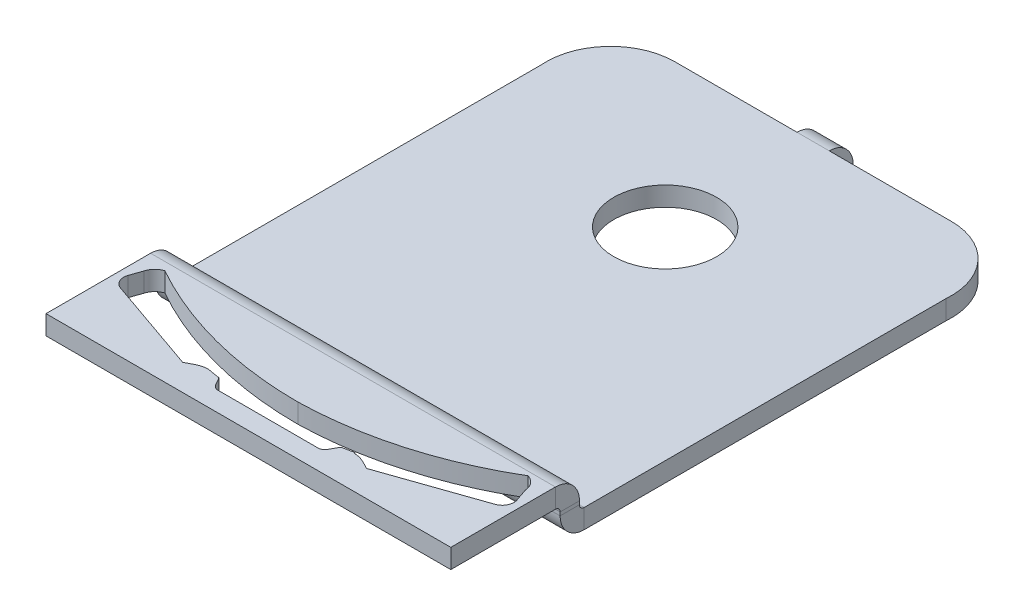
from build123d import *

# Parameters (mm, degrees)
BASE_FLANGE1_DEPTH           = 3
SKETCH2_R                    = 8
CUT_EXTRUDE1_DEPTH           = 73.112420355
EDGE_FLANGE1_STRIP_W         = 13.4732
EDGE_FLANGE1_STRIP_H         = 3
EDGE_FLANGE1_STRIP_CUT_DEPTH = 62.933077126
EDGE_FLANGE1_DEPTH           = 62.933077126
EDGE_FLANGE2_STRIP_W         = 13.4732
EDGE_FLANGE2_STRIP_H         = 3
EDGE_FLANGE2_STRIP_CUT_DEPTH = 62.933077126
EDGE_FLANGE2_DEPTH           = 62.933077126
CUT_EXTRUDE14_DEPTH          = 73.492766325
CUT_EXTRUDE15_DEPTH          = 73.492766325
CUT_EXTRUDE16_DEPTH          = 73.492766325
SKETCHED_START               = -2.498589927
SKETCHED_BEND2_DEPTH         = 5
SKETCHED_BEND2_2_DEPTH       = 5


# Read off the part's stored shape, not the designer's step: Sketched Bend2
# Sheet-metal steps are written as plain solids
with BuildPart() as part:
    # Sketch1 → Base-Flange1 (new body)
    with BuildSketch(Plane(origin=(0, 0, 0), x_dir=(1, 0, 0), z_dir=(0, 1, 0))):
        with BuildLine():
            Line((2.501410073, 64.8), (-2.498589927, 64.8))
            Line((-2.498589927, 64.8), (-2.498589927, 44.8))
            Line((-2.498589927, 44.8), (-21.498589927, 44.8))
            ThreePointArc((-21.498589927, 44.8), (-28.847059156, 41.582329983), (-31.466538563, 34))
            Line((-31.466538563, 34), (-31.466538563, -26))
            Line((-31.466538563, -26), (31.466538563, -26))
            Line((31.466538563, -26), (31.466538563, 34))
            ThreePointArc((31.466538563, 34), (28.848015597, 41.581293991), (21.501410073, 44.8))
            Line((21.501410073, 44.8), (2.501410073, 44.8))
            Line((2.501410073, 44.8), (2.501410073, 64.8))
        make_face()
    extrude(amount=-BASE_FLANGE1_DEPTH)

    # Sketch2 → Cut-Extrude1 (cut, through all)
    with BuildSketch(Plane(origin=(0, 0, 0), x_dir=(1, 0, 0), z_dir=(0, 1, 0))):
        with Locations(Location((0.000474376, 21.8, 0), (0, 0, 270))):
            Circle(SKETCH2_R)
    extrude(amount=-CUT_EXTRUDE1_DEPTH, mode=Mode.SUBTRACT)

    # Edge-Flange1 strip (across the edge) → Edge-Flange1 strip cut (cut)
    with BuildSketch(Plane(origin=(-31.466538563, 0, 26), x_dir=(0, 0, -1), z_dir=(1, 0, 0))):
        with Locations((-3, -1.5)):
            Rectangle(EDGE_FLANGE1_STRIP_W, EDGE_FLANGE1_STRIP_H)
    extrude(amount=EDGE_FLANGE1_STRIP_CUT_DEPTH, mode=Mode.SUBTRACT)

    # Edge-Flange1 section (across the edge) → Edge-Flange1 (add)
    with BuildSketch(Plane(origin=(-31.466538563, 0, 26), x_dir=(0, 0, -1), z_dir=(1, 0, 0))):
        with BuildLine():
            Line((0, 0.7366), (0, 2))
            Line((0, 2), (3, 2))
            Line((3, 2), (3, 0.7366))
            ThreePointArc((3, 0.7366), (3.215745145, 0.215745145), (3.7366, 0))
            Line((3.7366, 0), (3.7366, -3))
            ThreePointArc((3.7366, -3), (1.094424801, -1.905575199), (0, 0.7366))
        make_face()
    extrude(amount=EDGE_FLANGE1_DEPTH)

    # Edge-Flange2 strip (across the edge) → Edge-Flange2 strip cut (cut)
    with BuildSketch(Plane(origin=(31.466538563, 2, 26), x_dir=(0, -1, 0), z_dir=(-1, 0, 0))):
        with Locations((-6, -1.5)):
            Rectangle(EDGE_FLANGE2_STRIP_W, EDGE_FLANGE2_STRIP_H)
    extrude(amount=EDGE_FLANGE2_STRIP_CUT_DEPTH, mode=Mode.SUBTRACT)

    # Edge-Flange2 section (across the edge) → Edge-Flange2 (add)
    with BuildSketch(Plane(origin=(31.466538563, 2, 26), x_dir=(0, -1, 0), z_dir=(-1, 0, 0))):
        with BuildLine():
            Line((-3, 0.7366), (-3, 17))
            Line((-3, 17), (0, 17))
            Line((0, 17), (0, 0.7366))
            ThreePointArc((0, 0.7366), (0.215745145, 0.215745145), (0.7366, 0))
            Line((0.7366, 0), (0.7366, -3))
            ThreePointArc((0.7366, -3), (-1.905575199, -1.905575199), (-3, 0.7366))
        make_face()
    extrude(amount=EDGE_FLANGE2_DEPTH)

    # Sketch10 → Cut-Extrude14 (cut, through all)
    with BuildSketch(Plane(origin=(0, 5, 0), x_dir=(1, 0, 0), z_dir=(0, 1, 0))):
        with BuildLine():
            ThreePointArc((-27.999525624, -27.986488127), (-14.471973254, -33.456154948), (0, -35.319999998))
            ThreePointArc((0, -35.319999998), (14.426900142, -33.134483917), (27.829351114, -27.3650614))
            ThreePointArc((27.829351114, -27.3650614), (29.363428756, -28.706266155), (29.310299494, -30.743274178))
            ThreePointArc((29.310299494, -30.743274178), (26.455644788, -32.304474337), (23.521539899, -33.71068482))
            ThreePointArc((23.521539899, -33.71068482), (12.036275705, -37.463802008), (0.039934977, -38.907751924))
            ThreePointArc((0.039934977, -38.907751924), (-11.985574487, -37.731187287), (-23.551533984, -34.234651411))
            ThreePointArc((-23.551533984, -34.234651411), (-26.516212861, -32.894099815), (-29.404911166, -31.396828455))
            ThreePointArc((-29.404911166, -31.396828455), (-29.503369191, -29.361507737), (-27.999525624, -27.986488127))
        make_face()
    extrude(amount=-CUT_EXTRUDE14_DEPTH, mode=Mode.SUBTRACT)

    # Sketch12 → Cut-Extrude15 (cut, through all)
    with BuildSketch(Plane(origin=(0, 5, 0), x_dir=(1, 0, 0), z_dir=(0, 1, 0))):
        with BuildLine():
            Line((-7.914237019, -39.945550294), (7.914237019, -39.945550294))
            add(Edge.make_bspline(
                [(7.914237019, -39.945550294), (8.930869278, -39.730893974), (8.872112241, -38.554022125), (9.602345878, -38.030110388)],
                knots=[0, 0, 0, 0, 1, 1, 1, 1], degree=3))
            Line((9.602345878, -38.030110388), (11.562836506, -37.624091619))
            Line((11.562836506, -37.624091619), (0, -37.916784011))
            Line((0, -37.916784011), (-11.562836506, -37.624091619))
            Line((-11.562836506, -37.624091619), (-9.602345878, -38.030110388))
            add(Edge.make_bspline(
                [(-7.914237019, -39.945550294), (-8.930869278, -39.730893974), (-8.872112241, -38.554022125), (-9.602345878, -38.030110388)],
                knots=[0, 0, 0, 0, 1, 1, 1, 1], degree=3))
        make_face()
    extrude(amount=-CUT_EXTRUDE15_DEPTH, mode=Mode.SUBTRACT)

    # Sketch13 → Cut-Extrude16 (cut, through all)
    with BuildSketch(Plane(origin=(0, 5, 0), x_dir=(1, 0, 0), z_dir=(0, 1, 0))):
        with BuildLine():
            Line((-29.503369191, -29.361507737), (-30.236500006, -31.46681125))
            ThreePointArc((-30.236500006, -31.46681125), (-30.1571885, -32.842186741), (-29.128569459, -33.758642374))
            Line((-29.128569459, -33.758642374), (-14.274829355, -38.931167152))
            add(Edge.make_bspline(
                [(-14.274829355, -38.931167152), (-13.356001391, -38.419364556), (-12.413528872, -37.83920993), (-11.311548038, -37.858876708)],
                knots=[0, 0, 0, 0, 1, 1, 1, 1], degree=3))
            Line((-11.311548038, -37.858876708), (-10.639965658, -35.930319464))
            Line((-10.639965658, -35.930319464), (-29.503369191, -29.361507737))
        make_face()
        with BuildLine():
            Line((10.639965658, -35.930319464), (11.311548038, -37.858876708))
            add(Edge.make_bspline(
                [(14.274829355, -38.931167152), (13.356001391, -38.419364556), (12.413528872, -37.83920993), (11.311548038, -37.858876708)],
                knots=[0, 0, 0, 0, 1, 1, 1, 1], degree=3))
            Line((14.274829355, -38.931167152), (29.128569459, -33.758642374))
            ThreePointArc((29.128569459, -33.758642374), (30.1571885, -32.842186741), (30.236500006, -31.46681125))
            Line((30.236500006, -31.46681125), (29.503369191, -29.361507737))
            Line((29.503369191, -29.361507737), (10.639965658, -35.930319464))
        make_face()
    extrude(amount=-CUT_EXTRUDE16_DEPTH, mode=Mode.SUBTRACT)

    # Sketched Bend2 outline → Sketched Bend2 (cut)
    with BuildSketch(Plane.YZ.offset(SKETCHED_START)):
        with BuildLine():
            ThreePointArc((0, -44.8), (-0.845704021, -47.167467001), (-3, -48.463277222))
            Line((-3, -48.463277222), (-3, -64.8))
            Line((-3, -64.8), (0, -64.8))
            Line((0, -64.8), (0, -44.8))
        make_face()
    extrude(amount=SKETCHED_BEND2_DEPTH, mode=Mode.SUBTRACT)

    # Sketched Bend2 2 outline → Sketched Bend2 2 (add)
    with BuildSketch(Plane.YZ.offset(SKETCHED_START)):
        with BuildLine():
            ThreePointArc((-3, -44.8), (-3.215745145, -45.320854855), (-3.7366, -45.5366))
            Line((-3.7366, -45.5366), (-20.223356935, -45.5366))
            Line((-20.223356935, -45.5366), (-20.223356935, -48.5366))
            Line((-20.223356935, -48.5366), (-3.7366, -48.5366))
            ThreePointArc((-3.7366, -48.5366), (-3.36647982, -48.518224121), (-3, -48.463277222))
            Line((-3, -48.463277222), (-3, -44.8))
        make_face()
    extrude(amount=SKETCHED_BEND2_2_DEPTH)


solid = part.part
